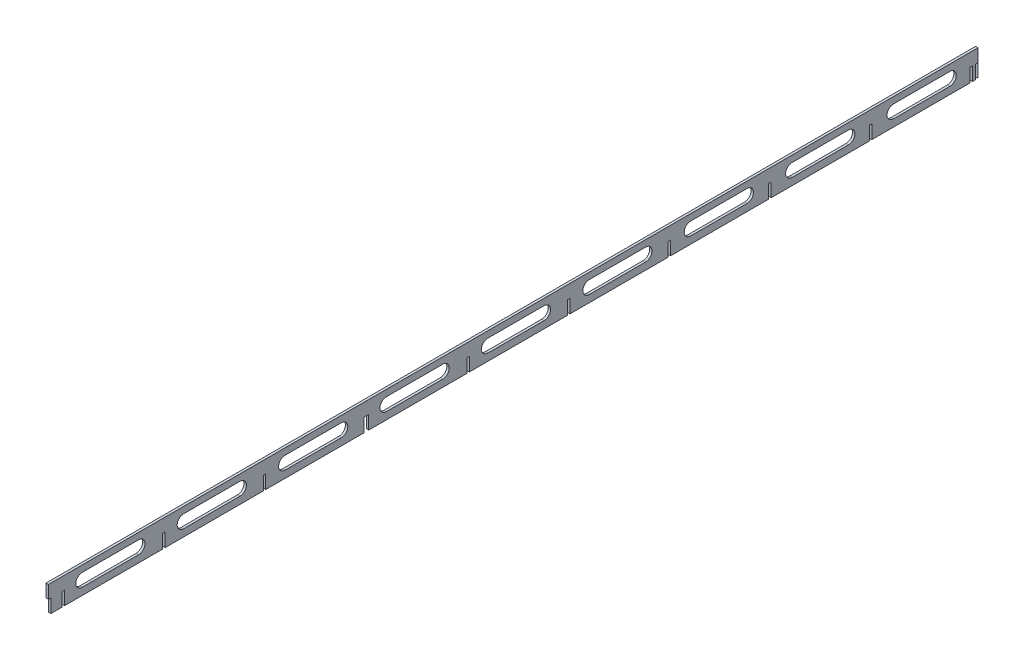
from build123d import *

# Parameters (mm, degrees)
SKETCH_1_W          = 3
SKETCH_1_H          = 32.905807398
EXTRUDE_1_DEPTH     = 1155
SKETCH_2_W          = 3
SKETCH_2_H          = 16.828171787
SKETCH_2_W_2        = 2.99
SKETCH_2_W_3        = 6
CUT_EXTRUDE_1_DEPTH = 3


with BuildPart() as part:
    # 草图1 → 凸台-拉伸1 (new body)
    with BuildSketch(Plane.XY):
        with Locations((-45.625456821, 5.194351007)):
            Rectangle(SKETCH_1_W, SKETCH_1_H)
    extrude(amount=EXTRUDE_1_DEPTH)

    # 草图2 → 切除-拉伸1 (cut)
    with BuildSketch(Plane.ZY.offset(47.125456821)):
        with Locations((8.51, -2.844466799)):
            Rectangle(SKETCH_2_W, SKETCH_2_H)
        with Locations((1153.505, -2.844466799)):
            Rectangle(SKETCH_2_W_2, SKETCH_2_H)
        with Locations((1136.51, -2.844466799)):
            Rectangle(SKETCH_2_W, SKETCH_2_H)
        with Locations((1011.51, -2.844466799)):
            Rectangle(SKETCH_2_W, SKETCH_2_H)
        with Locations((886.51, -2.844466799)):
            Rectangle(SKETCH_2_W, SKETCH_2_H)
        with Locations((760.01, -2.844466799)):
            Rectangle(SKETCH_2_W_3, SKETCH_2_H)
        with Locations((633.51, -2.844466799)):
            Rectangle(SKETCH_2_W, SKETCH_2_H)
        with Locations((508.51, -2.844466799)):
            Rectangle(SKETCH_2_W, SKETCH_2_H)
        with Locations((383.51, -2.844466799)):
            Rectangle(SKETCH_2_W, SKETCH_2_H)
        with Locations((258.51, -2.844466799)):
            Rectangle(SKETCH_2_W, SKETCH_2_H)
        with Locations((133.51, -2.844466799)):
            Rectangle(SKETCH_2_W, SKETCH_2_H)
        with Locations((1.51, -2.844466799)):
            Rectangle(SKETCH_2_W, SKETCH_2_H)
        with BuildLine():
            Line((105, 13.647254706), (35, 13.647254706))
            ThreePointArc((35, 13.647254706), (27, 5.647254706), (35, -2.352745294))
            Line((35, -2.352745294), (105, -2.352745294))
            ThreePointArc((105, -2.352745294), (113, 5.647254706), (105, 13.647254706))
        make_face()
        with BuildLine():
            Line((231, 13.647254706), (161, 13.647254706))
            ThreePointArc((161, 13.647254706), (153, 5.647254706), (161, -2.352745294))
            Line((161, -2.352745294), (231, -2.352745294))
            ThreePointArc((231, -2.352745294), (239, 5.647254706), (231, 13.647254706))
        make_face()
        with BuildLine():
            Line((357, 13.647254706), (287, 13.647254706))
            ThreePointArc((287, 13.647254706), (279, 5.647254706), (287, -2.352745294))
            Line((287, -2.352745294), (357, -2.352745294))
            ThreePointArc((357, -2.352745294), (365, 5.647254706), (357, 13.647254706))
        make_face()
        with BuildLine():
            Line((483, 13.647254706), (413, 13.647254706))
            ThreePointArc((413, 13.647254706), (405, 5.647254706), (413, -2.352745294))
            Line((413, -2.352745294), (483, -2.352745294))
            ThreePointArc((483, -2.352745294), (491, 5.647254706), (483, 13.647254706))
        make_face()
        with BuildLine():
            Line((609, 13.647254706), (539, 13.647254706))
            ThreePointArc((539, 13.647254706), (531, 5.647254706), (539, -2.352745294))
            Line((539, -2.352745294), (609, -2.352745294))
            ThreePointArc((609, -2.352745294), (617, 5.647254706), (609, 13.647254706))
        make_face()
        with BuildLine():
            Line((735, 13.647254706), (665, 13.647254706))
            ThreePointArc((665, 13.647254706), (657, 5.647254706), (665, -2.352745294))
            Line((665, -2.352745294), (735, -2.352745294))
            ThreePointArc((735, -2.352745294), (743, 5.647254706), (735, 13.647254706))
        make_face()
        with BuildLine():
            Line((861, 13.647254706), (791, 13.647254706))
            ThreePointArc((791, 13.647254706), (783, 5.647254706), (791, -2.352745294))
            Line((791, -2.352745294), (861, -2.352745294))
            ThreePointArc((861, -2.352745294), (869, 5.647254706), (861, 13.647254706))
        make_face()
        with BuildLine():
            Line((987, 13.647254706), (917, 13.647254706))
            ThreePointArc((917, 13.647254706), (909, 5.647254706), (917, -2.352745294))
            Line((917, -2.352745294), (987, -2.352745294))
            ThreePointArc((987, -2.352745294), (995, 5.647254706), (987, 13.647254706))
        make_face()
        with BuildLine():
            Line((1113, 13.647254706), (1043, 13.647254706))
            ThreePointArc((1043, 13.647254706), (1035, 5.647254706), (1043, -2.352745294))
            Line((1043, -2.352745294), (1113, -2.352745294))
            ThreePointArc((1113, -2.352745294), (1121, 5.647254706), (1113, 13.647254706))
        make_face()
    extrude(amount=-CUT_EXTRUDE_1_DEPTH, mode=Mode.SUBTRACT)


solid = part.part
